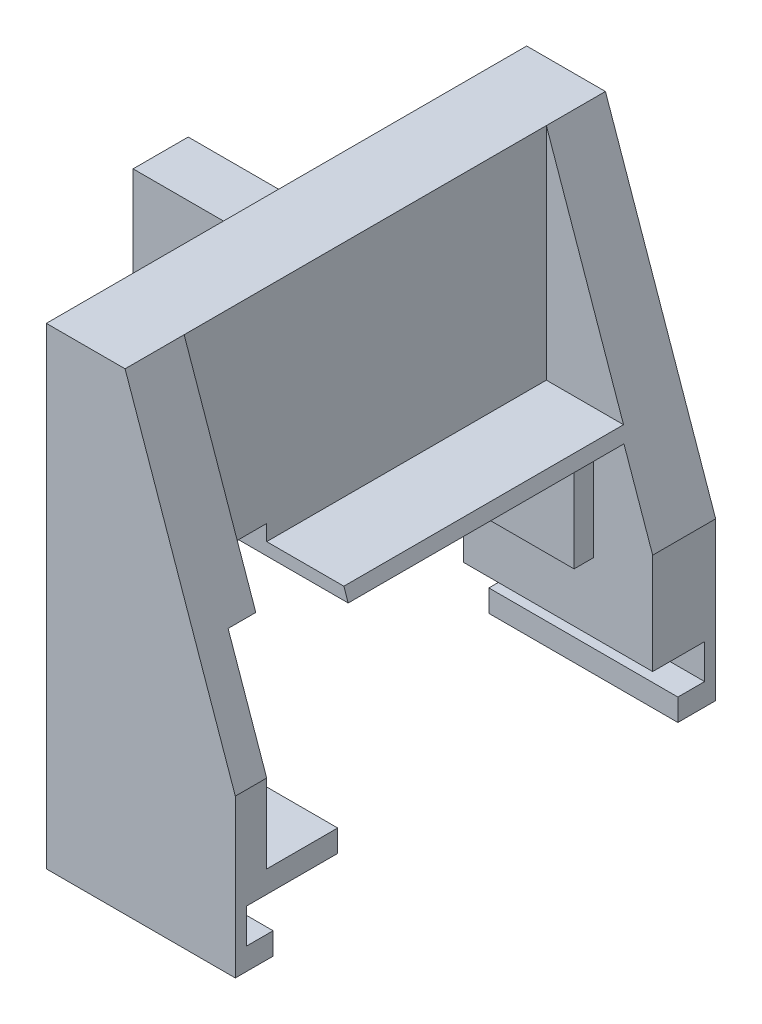
from build123d import *

# Parameters (mm, degrees)
BOSS_EXTRUDE1_DEPTH = 30.5
SKETCH4_W           = 20
SKETCH4_H           = 16
CUT_EXTRUDE2_DEPTH  = 25
CUT_EXTRUDE4_DEPTH  = 11.5
SKETCH8_W           = 7
SKETCH8_H           = 12
CUT_EXTRUDE5_DEPTH  = 45.432533126
CUT_EXTRUDE6_DEPTH  = 45.432533126
SKETCH7_W           = 28
SKETCH7_H           = 3.5
BOSS_EXTRUDE3_DEPTH = 8


with BuildPart() as part:
    # Sketch1 → Boss-Extrude1 (new body)
    with BuildSketch(Plane.XY):
        Polygon((0, 0), (0, -30), (12, -30), (12, -20), (5, 0), align=None)
    extrude(amount=-BOSS_EXTRUDE1_DEPTH)

    # Sketch4 → Cut-Extrude2 (cut)
    with BuildSketch(Plane.ZY):
        with Locations((-16.5, -22.788025353)):
            Rectangle(SKETCH4_W, SKETCH4_H)
    extrude(amount=-CUT_EXTRUDE2_DEPTH, mode=Mode.SUBTRACT)

    # Sketch6 → Cut-Extrude4 (cut, symmetric)
    with BuildSketch(Plane.XY.offset(-15.25)):
        Polygon((5, 0), (5, -14), (9.9, -14), align=None)
    extrude(amount=CUT_EXTRUDE4_DEPTH, both=True, mode=Mode.SUBTRACT)

    # Sketch8 → Cut-Extrude5 (cut, through all)
    with BuildSketch(Plane.ZY):
        with Locations((-5.491214764, -19)):
            Rectangle(SKETCH8_W, SKETCH8_H)
    extrude(amount=-CUT_EXTRUDE5_DEPTH, mode=Mode.SUBTRACT)

    # Sketch9 → Cut-Extrude6 (cut, through all)
    with BuildSketch(Plane.ZY):
        Polygon((-6.5, -26.4), (-0.7, -26.4), (-0.7, -28.6), (-2.4, -28.6), (-2.4, -30.296685761), (-6.5, -30.296685761), align=None)
        Polygon((-24, -30.296685761), (-24, -26.4), (-29.8, -26.4), (-29.8, -28.6), (-28.1, -28.6), (-28.1, -30.296685761), align=None)
    extrude(amount=-CUT_EXTRUDE6_DEPTH, mode=Mode.SUBTRACT)

    # Sketch7 → Boss-Extrude3 (add)
    with BuildSketch(Plane(origin=(0, -22, 0), x_dir=(1, 0, 0), z_dir=(0, 1, 0))):
        with Locations((-5.74122689, 27)):
            Rectangle(SKETCH7_W, SKETCH7_H)
    extrude(amount=BOSS_EXTRUDE3_DEPTH)


solid = part.part
